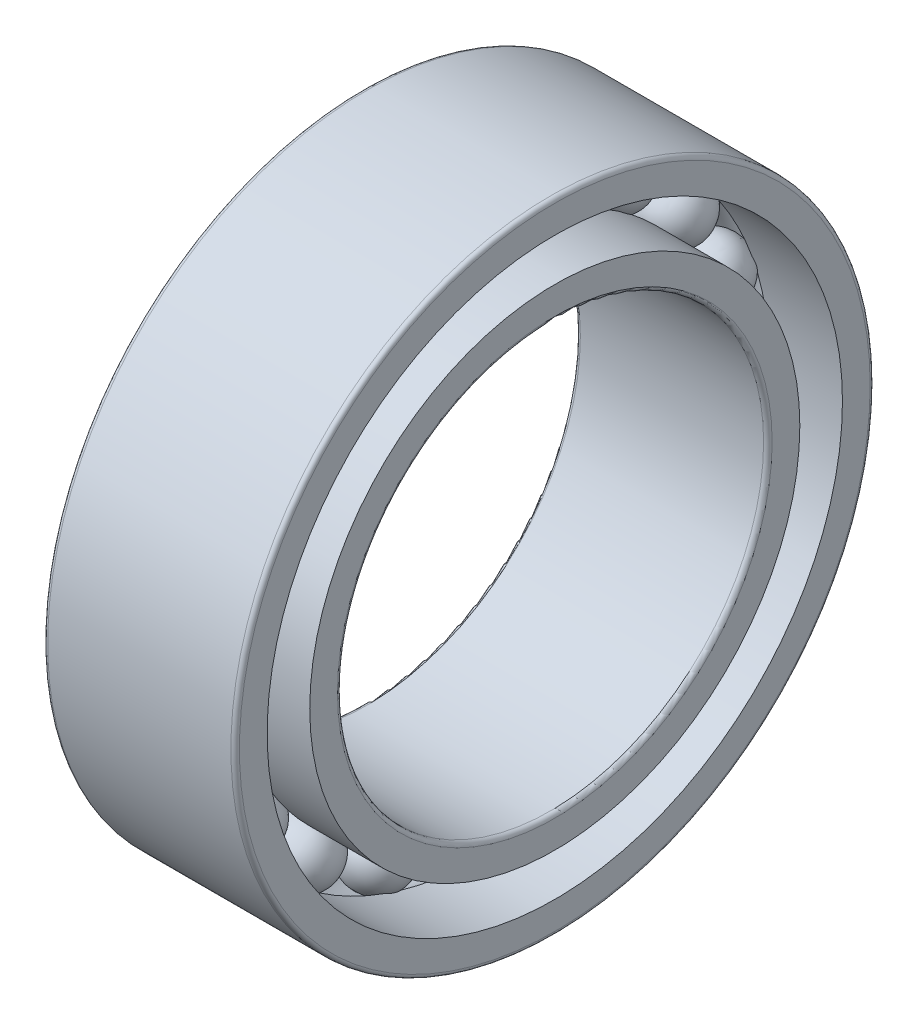
from build123d import *

# Parameters (mm, degrees)
CAGSPISKE_W         = 0.15
CAGSPISKE_H         = 0.25
CAGESPINE_ANGLE     = 0.001
BALLSDETAILED_COUNT = 20
BALLSDETAILED_ANGLE = 342


with BuildPart() as part:
    # CagSpiSke → CageSpine (revolve)
    with BuildSketch(Plane.XY):
        with Locations((0, 6.25)):
            Rectangle(CAGSPISKE_W, CAGSPISKE_H)
    revolve(axis=Axis((-20.6375, 0, 0), (-1, 0, 0)), revolution_arc=CAGESPINE_ANGLE)

    # BalDetSke → BallDetailed (revolve)
    with BuildSketch(Plane.XY):
        with BuildLine():
            Line((-0.75, 6.25), (0.75, 6.25))
            ThreePointArc((0.75, 6.25), (0, 5.5), (-0.75, 6.25))
        make_face()
    balldetailed = revolve(axis=Axis((-1.905, 6.25, 0), (1, 0, 0)))

    # InnRacSke → InnerRace (revolve)
    with BuildSketch(Plane.XY):
        with BuildLine():
            Line((-0.525, 5.75), (-2.25, 5.75))
            Line((-2.25, 5.75), (-2.25, 5.1))
            ThreePointArc((-2.25, 5.1), (-2.220710678, 5.029289322), (-2.15, 5))
            Line((-2.15, 5), (2.15, 5))
            ThreePointArc((2.15, 5), (2.220710678, 5.029289322), (2.25, 5.1))
            Line((2.25, 5.1), (2.25, 5.75))
            Line((2.25, 5.75), (0.525, 5.75))
            ThreePointArc((0.525, 5.75), (0, 5.525), (-0.525, 5.75))
        make_face()
    revolve(axis=Axis((-20.6375, 0, 0), (1, 0, 0)))

    # OutRacSke → OuterRace (revolve)
    with BuildSketch(Plane.XY):
        with BuildLine():
            Line((-0.525, 6.75), (-2.25, 6.75))
            Line((-2.25, 6.75), (-2.25, 7.4))
            ThreePointArc((-2.25, 7.4), (-2.220710678, 7.470710678), (-2.15, 7.5))
            Line((-2.15, 7.5), (2.15, 7.5))
            ThreePointArc((2.15, 7.5), (2.220710678, 7.470710678), (2.25, 7.4))
            Line((2.25, 7.4), (2.25, 6.75))
            Line((2.25, 6.75), (0.525, 6.75))
            ThreePointArc((0.525, 6.75), (0, 6.975), (-0.525, 6.75))
        make_face()
    revolve(axis=Axis((-20.6375, 0, 0), (1, 0, 0)))

    # BallsDetailed: BallDetailed ×20 about axis
    ballsdetailed_axis = Axis((-50, 0, 0), (1, 0, 0))
    for i in range(1, BALLSDETAILED_COUNT):
        add(balldetailed.rotate(ballsdetailed_axis, i * BALLSDETAILED_ANGLE / (BALLSDETAILED_COUNT - 1)))


solid = part.part
